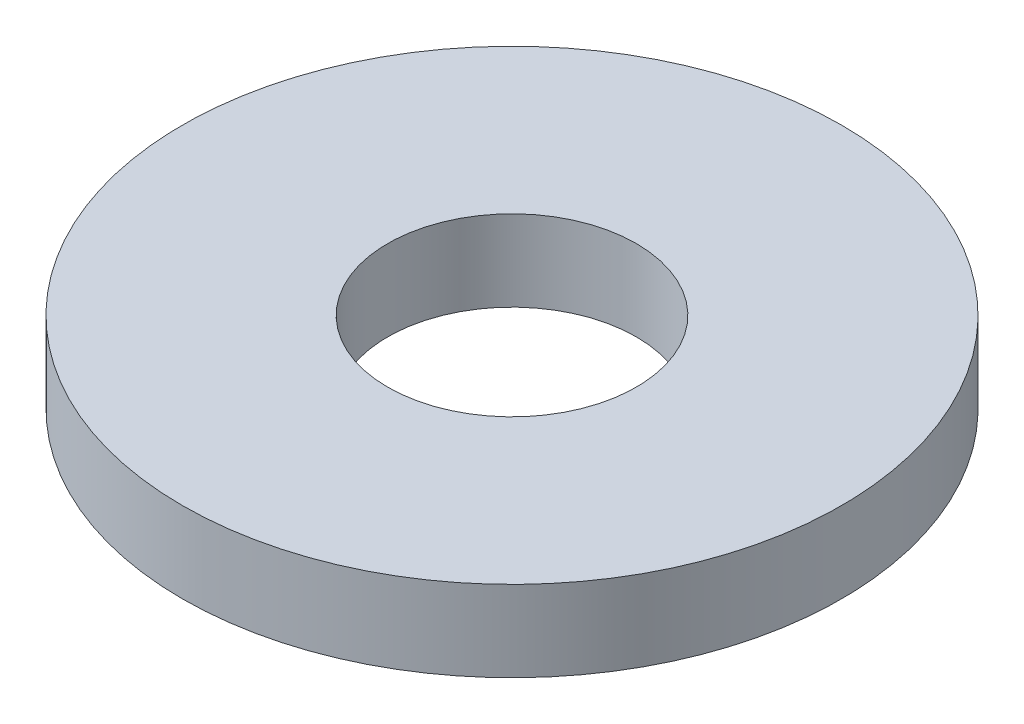
from build123d import *

# Parameters (mm, degrees)
SKETCH2_R           = 13.25
SKETCH2_R_2         = 5
BOSS_EXTRUDE1_DEPTH = 3.25


with BuildPart() as part:
    # Sketch2 → Boss-Extrude1 (new body)
    with BuildSketch(Plane(origin=(0, 0, 0), x_dir=(1, 0, 0), z_dir=(0, 1, 0))):
        Circle(SKETCH2_R)
        Circle(SKETCH2_R_2, mode=Mode.SUBTRACT)
    extrude(amount=BOSS_EXTRUDE1_DEPTH)


solid = part.part
